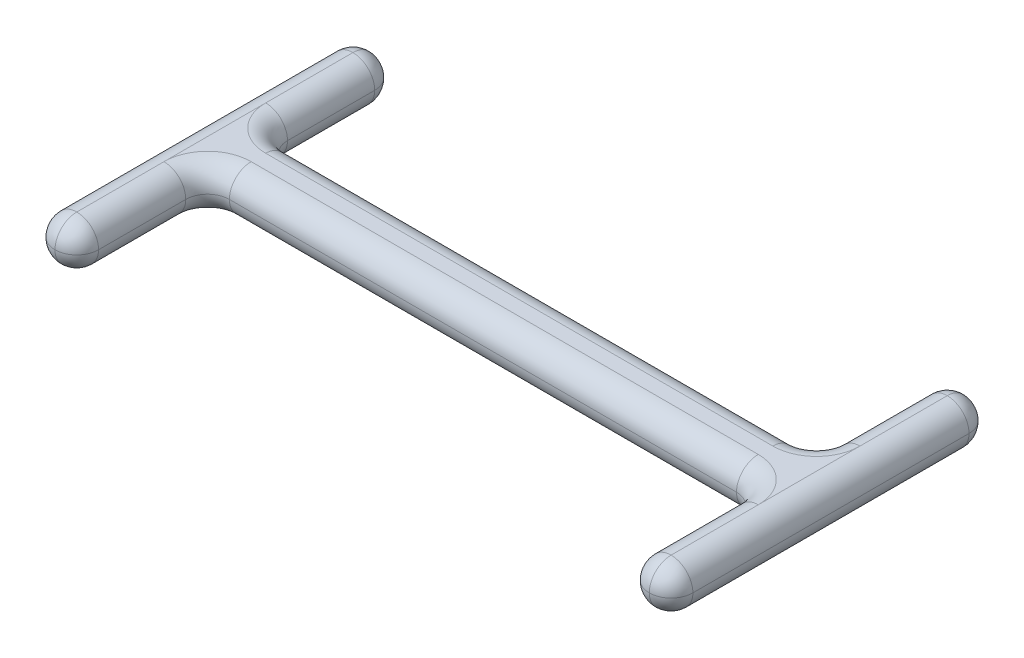
from build123d import *

# Parameters (mm, degrees)
BOSS_EXTRUDE1_DEPTH = 7.5
FILLET1_R           = 3.75
FILLET2_R           = 3.75


# Some blends are built 0.0001 mm under size
with BuildPart() as part:
    # Sketch2 → Boss-Extrude1 (new body)
    with BuildSketch(Plane(origin=(0, 0, 0), x_dir=(1, 0, 0), z_dir=(0, 1, 0))):
        Polygon((-54.865, 27.5), (-54.865, -27.5), (-47.365, -27.5), (-47.365, -5), (47.365, -5), (47.365, -27.5), (54.865, -27.5), (54.865, 27.5), (47.365, 27.5), (47.365, 5), (-47.365, 5), (-47.365, 27.5), align=None)
    extrude(amount=BOSS_EXTRUDE1_DEPTH)

    # Fillet1
    fillet1_edges = [part.edges().sort_by_distance(p)[0] for p in [
        (0, 7.5, 5),
        (-54.865, 0, 0),
        (-47.365, 0, -16.25),
        (0, 0, -5),
        (47.365, 0, -16.25),
        (47.365, 7.5, 16.25),
        (54.865, 0, 0),
        (47.365, 0, 16.25),
        (0, 0, 5),
        (-47.365, 0, 16.25),
        (54.865, 7.5, 0),
        (-54.865, 3.75, 27.5),
        (-54.865, 3.75, -27.5),
        (-47.365, 3.75, -27.5),
        (-47.365, 3.75, -5),
        (47.365, 3.75, -5),
        (47.365, 3.75, -27.5),
        (54.865, 3.75, -27.5),
        (54.865, 3.75, 27.5),
        (47.365, 3.75, 27.5),
        (47.365, 3.75, 5),
        (-47.365, 3.75, 5),
        (-47.365, 3.75, 27.5),
        (47.365, 7.5, -16.25),
        (0, 7.5, -5),
        (-47.365, 7.5, -16.25),
        (-54.865, 7.5, 0),
        (-47.365, 7.5, 16.25),
    ]]
    fillet(fillet1_edges, radius=FILLET1_R - 0.0001)  # a hair under: the kernel refuses the full size

    # Fillet2
    # the kernel refuses this fillet: 3.75 mm, written as the material it takes off along each edge
    with BuildSketch(Plane(origin=(-47.365, 3.75, -23.75), x_dir=(0, 0, -1), z_dir=(0, -1, 0))) as fillet2_piece_1:
        with BuildLine():
            CenterArc((0.0001, -3.7499), 3.7499, 0, 90)
            Line((3.75, -3.7499), (3.75, 0))
            Line((3.75, 0), (0.0001, 0))
        make_face()
    revolve(axis=Axis((-47.365, 3.75, -23.75), (1, 0, 0)), revolution_arc=90, mode=Mode.SUBTRACT)
    with BuildSketch(Plane(origin=(-47.365, 3.75, -23.75), x_dir=(0, -1, 0), z_dir=(0, 0, 1))) as fillet2_piece_2:
        with BuildLine():
            CenterArc((0.0001, -3.7499), 3.7499, 0, 90)
            Line((3.75, -3.7499), (3.75, 0))
            Line((3.75, 0), (0.0001, 0))
        make_face()
    revolve(axis=Axis((-47.365, 3.75, -23.75), (1, 0, 0)), revolution_arc=90, mode=Mode.SUBTRACT)
    with BuildSketch(Plane(origin=(-54.865, 3.75, 23.75), x_dir=(0, 0, 1), z_dir=(0, -1, 0))) as fillet2_piece_3:
        with BuildLine():
            CenterArc((0.0001, -3.7499), 3.7499, 0, 90)
            Line((3.75, -3.7499), (3.75, 0))
            Line((3.75, 0), (0.0001, 0))
        make_face()
    revolve(axis=Axis((-54.865, 3.75, 23.75), (-1, 0, 0)), revolution_arc=90, mode=Mode.SUBTRACT)
    with BuildSketch(Plane(origin=(-54.865, 3.75, 23.75), x_dir=(0, -1, 0), z_dir=(0, 0, -1))) as fillet2_piece_4:
        with BuildLine():
            CenterArc((0.0001, -3.7499), 3.7499, 0, 90)
            Line((3.75, -3.7499), (3.75, 0))
            Line((3.75, 0), (0.0001, 0))
        make_face()
    revolve(axis=Axis((-54.865, 3.75, 23.75), (-1, 0, 0)), revolution_arc=90, mode=Mode.SUBTRACT)
    with BuildSketch(Plane(origin=(47.365, 3.75, 23.75), x_dir=(0, -1, 0), z_dir=(0, 0, -1))) as fillet2_piece_5:
        with BuildLine():
            CenterArc((0.0001, -3.7499), 3.7499, 0, 90)
            Line((3.75, -3.7499), (3.75, 0))
            Line((3.75, 0), (0.0001, 0))
        make_face()
    revolve(axis=Axis((47.365, 3.75, 23.75), (-1, 0, 0)), revolution_arc=90, mode=Mode.SUBTRACT)
    with BuildSketch(Plane(origin=(47.365, 3.75, 23.75), x_dir=(0, 0, 1), z_dir=(0, -1, 0))) as fillet2_piece_6:
        with BuildLine():
            CenterArc((0.0001, -3.7499), 3.7499, 0, 90)
            Line((3.75, -3.7499), (3.75, 0))
            Line((3.75, 0), (0.0001, 0))
        make_face()
    revolve(axis=Axis((47.365, 3.75, 23.75), (-1, 0, 0)), revolution_arc=90, mode=Mode.SUBTRACT)
    with BuildSketch(Plane(origin=(54.865, 3.75, -23.75), x_dir=(0, -1, 0), z_dir=(0, 0, 1))) as fillet2_piece_7:
        with BuildLine():
            CenterArc((0.0001, -3.7499), 3.7499, 0, 90)
            Line((3.75, -3.7499), (3.75, 0))
            Line((3.75, 0), (0.0001, 0))
        make_face()
    revolve(axis=Axis((54.865, 3.75, -23.75), (1, 0, 0)), revolution_arc=90, mode=Mode.SUBTRACT)
    with BuildSketch(Plane(origin=(54.865, 3.75, -23.75), x_dir=(0, 0, -1), z_dir=(0, -1, 0))) as fillet2_piece_8:
        with BuildLine():
            CenterArc((0.0001, -3.7499), 3.7499, 0, 90)
            Line((3.75, -3.7499), (3.75, 0))
            Line((3.75, 0), (0.0001, 0))
        make_face()
    revolve(axis=Axis((54.865, 3.75, -23.75), (1, 0, 0)), revolution_arc=90, mode=Mode.SUBTRACT)
    with BuildSketch(Plane(origin=(-54.865, 3.75, -23.75), x_dir=(0, 1, 0), z_dir=(0, 0, 1))) as fillet2_piece_9:
        with BuildLine():
            CenterArc((0.0001, -3.7499), 3.7499, 0, 90)
            Line((3.75, -3.7499), (3.75, 0))
            Line((3.75, 0), (0.0001, 0))
        make_face()
    revolve(axis=Axis((-54.865, 3.75, -23.75), (-1, 0, 0)), revolution_arc=90, mode=Mode.SUBTRACT)
    with BuildSketch(Plane(origin=(-54.865, 3.75, -23.75), x_dir=(0, 0, -1), z_dir=(0, 1, 0))) as fillet2_piece_10:
        with BuildLine():
            CenterArc((0.0001, -3.7499), 3.7499, 0, 90)
            Line((3.75, -3.7499), (3.75, 0))
            Line((3.75, 0), (0.0001, 0))
        make_face()
    revolve(axis=Axis((-54.865, 3.75, -23.75), (-1, 0, 0)), revolution_arc=90, mode=Mode.SUBTRACT)
    with BuildSketch(Plane(origin=(-47.365, 3.75, 23.75), x_dir=(0, 1, 0), z_dir=(0, 0, -1))) as fillet2_piece_11:
        with BuildLine():
            CenterArc((0.0001, -3.7499), 3.7499, 0, 90)
            Line((3.75, -3.7499), (3.75, 0))
            Line((3.75, 0), (0.0001, 0))
        make_face()
    revolve(axis=Axis((-47.365, 3.75, 23.75), (1, 0, 0)), revolution_arc=90, mode=Mode.SUBTRACT)
    with BuildSketch(Plane(origin=(-47.365, 3.75, 23.75), x_dir=(0, 0, 1), z_dir=(0, 1, 0))) as fillet2_piece_12:
        with BuildLine():
            CenterArc((0.0001, -3.7499), 3.7499, 0, 90)
            Line((3.75, -3.7499), (3.75, 0))
            Line((3.75, 0), (0.0001, 0))
        make_face()
    revolve(axis=Axis((-47.365, 3.75, 23.75), (1, 0, 0)), revolution_arc=90, mode=Mode.SUBTRACT)
    with BuildSketch(Plane(origin=(54.865, 3.75, 23.75), x_dir=(0, 0, 1), z_dir=(0, 1, 0))) as fillet2_piece_13:
        with BuildLine():
            CenterArc((0.0001, -3.7499), 3.7499, 0, 90)
            Line((3.75, -3.7499), (3.75, 0))
            Line((3.75, 0), (0.0001, 0))
        make_face()
    revolve(axis=Axis((54.865, 3.75, 23.75), (1, 0, 0)), revolution_arc=90, mode=Mode.SUBTRACT)
    with BuildSketch(Plane(origin=(54.865, 3.75, 23.75), x_dir=(0, 1, 0), z_dir=(0, 0, -1))) as fillet2_piece_14:
        with BuildLine():
            CenterArc((0.0001, -3.7499), 3.7499, 0, 90)
            Line((3.75, -3.7499), (3.75, 0))
            Line((3.75, 0), (0.0001, 0))
        make_face()
    revolve(axis=Axis((54.865, 3.75, 23.75), (1, 0, 0)), revolution_arc=90, mode=Mode.SUBTRACT)
    with BuildSketch(Plane(origin=(47.365, 3.75, -23.75), x_dir=(0, 0, -1), z_dir=(0, 1, 0))) as fillet2_piece_15:
        with BuildLine():
            CenterArc((0.0001, -3.7499), 3.7499, 0, 90)
            Line((3.75, -3.7499), (3.75, 0))
            Line((3.75, 0), (0.0001, 0))
        make_face()
    revolve(axis=Axis((47.365, 3.75, -23.75), (-1, 0, 0)), revolution_arc=90, mode=Mode.SUBTRACT)
    with BuildSketch(Plane(origin=(47.365, 3.75, -23.75), x_dir=(0, 1, 0), z_dir=(0, 0, 1))) as fillet2_piece_16:
        with BuildLine():
            CenterArc((0.0001, -3.7499), 3.7499, 0, 90)
            Line((3.75, -3.7499), (3.75, 0))
            Line((3.75, 0), (0.0001, 0))
        make_face()
    revolve(axis=Axis((47.365, 3.75, -23.75), (-1, 0, 0)), revolution_arc=90, mode=Mode.SUBTRACT)
    with BuildSketch(Plane(origin=(54.865, 7.5, -27.5), x_dir=(0, 0, 1), z_dir=(-1, 0, 0)), Plane(origin=(47.365, 7.5, 27.5), x_dir=(0, 0, -1), z_dir=(1, 0, 0))) as fillet2_piece_17:
        with BuildLine():
            CenterArc((FILLET2_R, -FILLET2_R), FILLET2_R, 90, 90)
            Line((0, -FILLET2_R), (0, 0))
            Line((0, 0), (FILLET2_R, 0))
        make_face()
    extrude(amount=7.5, mode=Mode.SUBTRACT)
    with BuildSketch(Plane(origin=(54.865, 0, -27.5), x_dir=(0, 0, 1), z_dir=(-1, 0, 0)), Plane(origin=(47.365, 0, 27.5), x_dir=(0, 0, -1), z_dir=(1, 0, 0)), Plane(origin=(-54.865, 0, 27.5), x_dir=(0, 0, -1), z_dir=(1, 0, 0)), Plane(origin=(-54.865, 7.5, 27.5), x_dir=(0, -1, 0), z_dir=(1, 0, 0)), Plane(origin=(-47.365, 0, -27.5), x_dir=(0, 0, 1), z_dir=(-1, 0, 0)), Plane(origin=(-47.365, 7.5, -27.5), x_dir=(0, -1, 0), z_dir=(-1, 0, 0))) as fillet2_piece_18:
        with BuildLine():
            CenterArc((FILLET2_R, FILLET2_R), FILLET2_R, 180, 90)
            Line((0, FILLET2_R), (0, 0))
            Line((0, 0), (FILLET2_R, 0))
        make_face()
    extrude(amount=7.5, mode=Mode.SUBTRACT)


solid = part.part
